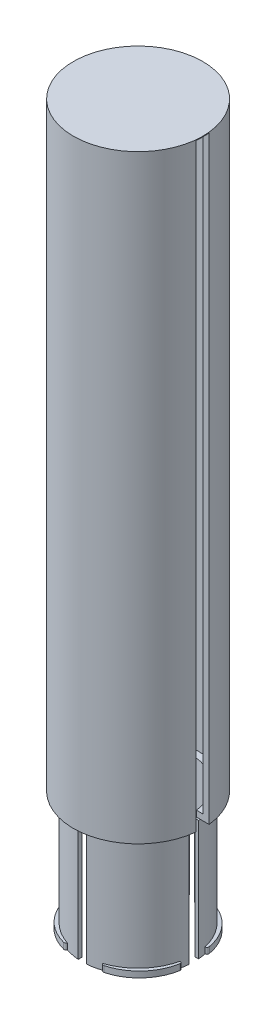
from build123d import *

# Parameters (mm, degrees)
SKETCH1_R           = 21.59
BOSS_EXTRUDE1_DEPTH = 200
SHELL1_T            = 2
CUT_EXTRUDE1_START  = 20
CUT_EXTRUDE1_DEPTH  = 5
SKETCH4_R           = 18.651037357
BOSS_EXTRUDE2_DEPTH = 40
SKETCH7_R           = 17.409680213
CUT_EXTRUDE4_DEPTH  = 62
SKETCH8_W           = 2.785852998
SKETCH8_H           = 5.87658936
SKETCH8_W_2         = 8.878050256
SKETCH8_H_2         = 3.207420782
SKETCH8_W_3         = 2.758641046
SKETCH8_H_3         = 8.505589864
CUT_EXTRUDE5_DEPTH  = 203.317216766
BOSS_EXTRUDE4_DEPTH = 2


with BuildPart() as part:
    # Sketch1 → Boss-Extrude1 (new body)
    with BuildSketch(Plane(origin=(0, 0, 0), x_dir=(1, 0, 0), z_dir=(0, 1, 0))):
        Circle(SKETCH1_R)
    extrude(amount=BOSS_EXTRUDE1_DEPTH)

    # Shell1 (no face opened: a closed hollow body)
    add(offset(amount=-SHELL1_T, mode=Mode.PRIVATE), mode=Mode.SUBTRACT)

    # Sketch2 → Cut-Extrude1 (cut, symmetric)
    with BuildSketch(Plane(origin=(0, 0, 0), x_dir=(0, 0, -1), z_dir=(1, 0, 0)).offset(CUT_EXTRUDE1_START)):
        Polygon((2.213988381, 104.269834735), (2.213988381, 0), (-2.213988381, 0), (-2.213988381, 104.269834735), (-2.213988381, 199.79439609), (2.213988381, 199.79439609), align=None)
    extrude(amount=CUT_EXTRUDE1_DEPTH, both=True, mode=Mode.SUBTRACT)

    # Sketch4 → Boss-Extrude2 (add)
    with BuildSketch(Plane.XZ):
        Circle(SKETCH4_R)
    extrude(amount=BOSS_EXTRUDE2_DEPTH)

    # Sketch7 → Cut-Extrude4 (cut)
    with BuildSketch(Plane(origin=(0, -40, 0), x_dir=(-1, 0, 0), z_dir=(0, -1, 0))):
        Circle(SKETCH7_R)
    extrude(amount=-CUT_EXTRUDE4_DEPTH, mode=Mode.SUBTRACT)

    # Sketch8 → Cut-Extrude5 (cut, through all)
    with BuildSketch(Plane(origin=(0, 0, 0), x_dir=(1, 0, 0), z_dir=(0, 1, 0))):
        with Locations((0, 20.108138302)):
            Rectangle(SKETCH8_W, SKETCH8_H)
        with Locations((18.709836445, -0.001004202)):
            Rectangle(SKETCH8_W_2, SKETCH8_H_2)
        with Locations((0.013605976, -18.452209414)):
            Rectangle(SKETCH8_W_3, SKETCH8_H_3)
        with Locations((-18.709836445, -0.001004202)):
            Rectangle(SKETCH8_W_2, SKETCH8_H_2)
    extrude(amount=-CUT_EXTRUDE5_DEPTH, mode=Mode.SUBTRACT)

    # Sketch9 → Boss-Extrude4 (add)
    with BuildSketch(Plane.XZ.offset(40)):
        with BuildLine():
            ThreePointArc((18.832779949, 4.924358061), (14.708668429, 13.306015403), (6.695933374, 18.107739321))
            ThreePointArc((6.695933374, 18.107739321), (5.893480657, 17.635029705), (6.366190274, 16.832576988))
            ThreePointArc((6.366190274, 16.832576988), (13.739666938, 12.413936035), (17.534755611, 4.700969813))
            ThreePointArc((17.534755611, 4.700969813), (18.295461904, 4.163651768), (18.832779949, 4.924358061))
        make_face()
        with BuildLine():
            ThreePointArc((18.832779949, -4.924358061), (14.708668429, -13.306015403), (6.695933374, -18.107739321))
            ThreePointArc((6.695933374, -18.107739321), (5.893480657, -17.635029705), (6.366190274, -16.832576988))
            ThreePointArc((6.366190274, -16.832576988), (13.739666938, -12.413936035), (17.534755611, -4.700969813))
            ThreePointArc((17.534755611, -4.700969813), (18.295461904, -4.163651768), (18.832779949, -4.924358061))
        make_face()
        with BuildLine():
            ThreePointArc((-18.832779949, -4.924358061), (-14.708668429, -13.306015403), (-6.695933374, -18.107739321))
            ThreePointArc((-6.695933374, -18.107739321), (-5.893480657, -17.635029705), (-6.366190274, -16.832576988))
            ThreePointArc((-6.366190274, -16.832576988), (-13.739666938, -12.413936035), (-17.534755611, -4.700969813))
            ThreePointArc((-17.534755611, -4.700969813), (-18.295461904, -4.163651768), (-18.832779949, -4.924358061))
        make_face()
        with BuildLine():
            ThreePointArc((-18.832779949, 4.924358061), (-14.708668429, 13.306015403), (-6.695933374, 18.107739321))
            ThreePointArc((-6.695933374, 18.107739321), (-5.893480657, 17.635029705), (-6.366190274, 16.832576988))
            ThreePointArc((-6.366190274, 16.832576988), (-13.739666938, 12.413936035), (-17.534755611, 4.700969813))
            ThreePointArc((-17.534755611, 4.700969813), (-18.295461904, 4.163651768), (-18.832779949, 4.924358061))
        make_face()
    extrude(amount=-BOSS_EXTRUDE4_DEPTH)


solid = part.part
